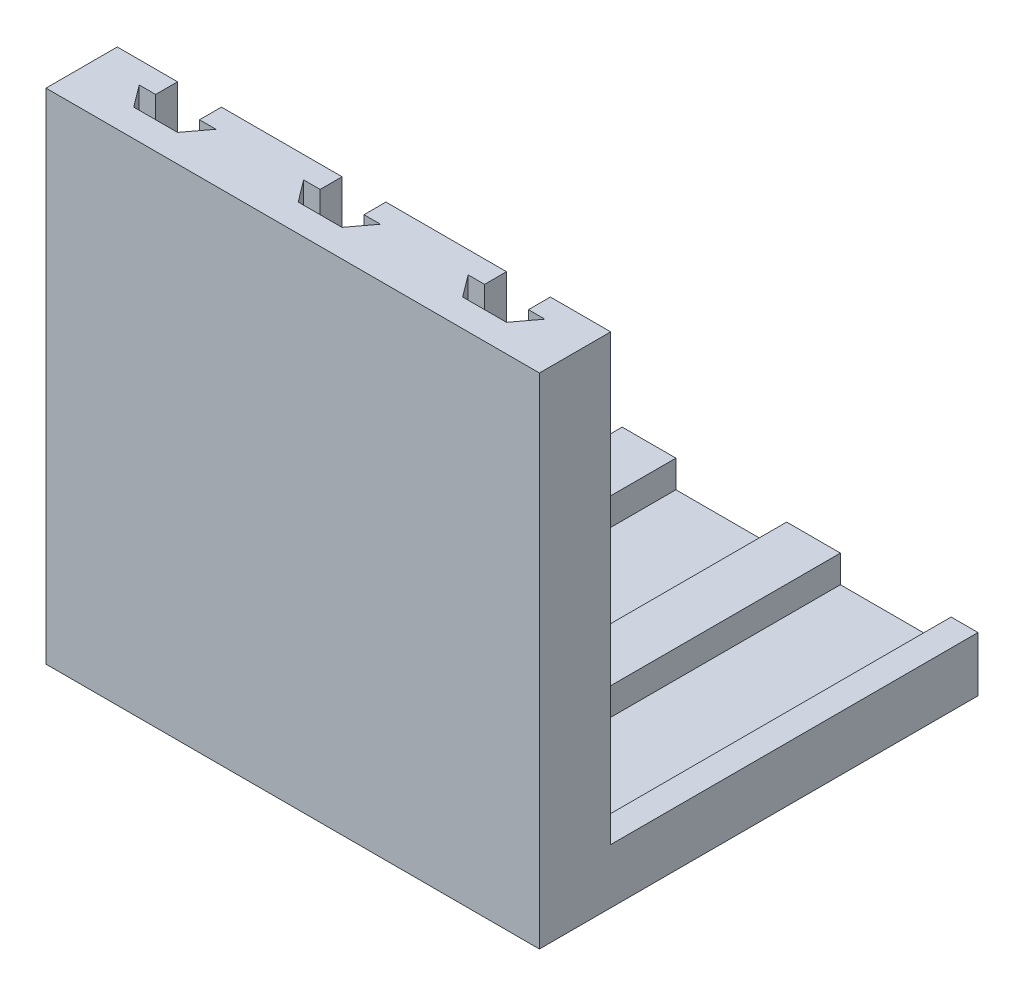
from build123d import *

# Parameters (mm, degrees)
SKETCH1_W           = 30
SKETCH1_H           = 80
BOSS_EXTRUDE1_DEPTH = 10
SKETCH2_W           = 30
SKETCH2_H           = 13
BOSS_EXTRUDE2_DEPTH = 81
CUT_EXTRUDE1_DEPTH  = 40
SKETCH4_W           = 20.2
SKETCH4_H           = 67
CUT_EXTRUDE2_DEPTH  = 5
SKETCH5_W           = 8
SKETCH5_H           = 2
CUT_EXTRUDE3_DEPTH  = 46
LPATTERN1_COUNT     = 3
LPATTERN1_PITCH     = 30


with BuildPart() as part:
    # Sketch1 → Boss-Extrude1 (new body)
    with BuildSketch(Plane(origin=(0, 0, 0), x_dir=(1, 0, 0), z_dir=(0, 1, 0))):
        Rectangle(SKETCH1_W, SKETCH1_H)
    boss_extrude1 = extrude(amount=BOSS_EXTRUDE1_DEPTH)

    # Sketch2 → Boss-Extrude2 (add)
    with BuildSketch(Plane(origin=(0, 10, 0), x_dir=(1, 0, 0), z_dir=(0, 1, 0))):
        with Locations((0, -33.5)):
            Rectangle(SKETCH2_W, SKETCH2_H)
    boss_extrude2 = extrude(amount=BOSS_EXTRUDE2_DEPTH)

    # Sketch3 → Cut-Extrude1 (cut)
    with BuildSketch(Plane(origin=(0, 91, 0), x_dir=(1, 0, 0), z_dir=(0, 1, 0))):
        Polygon((-4, -27), (4, -27), (4, -31), (7, -31), (4, -35), (-4, -35), (-7, -31), (-4, -31), align=None)
    cut_extrude1 = extrude(amount=-CUT_EXTRUDE1_DEPTH, mode=Mode.SUBTRACT)

    # Sketch4 → Cut-Extrude2 (cut)
    with BuildSketch(Plane(origin=(0, 10, 0), x_dir=(1, 0, 0), z_dir=(0, 1, 0))):
        with Locations((0, 6.5)):
            Rectangle(SKETCH4_W, SKETCH4_H)
    cut_extrude2 = extrude(amount=-CUT_EXTRUDE2_DEPTH, mode=Mode.SUBTRACT)

    # Sketch5 → Cut-Extrude3 (cut)
    with BuildSketch(Plane(origin=(0, 51, 0), x_dir=(1, 0, 0), z_dir=(0, 1, 0))):
        with Locations((0, -28)):
            Rectangle(SKETCH5_W, SKETCH5_H)
    cut_extrude3 = extrude(amount=-CUT_EXTRUDE3_DEPTH, mode=Mode.SUBTRACT)

    # LPattern1: Boss-Extrude1, Boss-Extrude2, Cut-Extrude1, Cut-Extrude2, Cut-Extrude3 ×3
    with Locations(*[(-i * LPATTERN1_PITCH, 0, 0) for i in range(1, LPATTERN1_COUNT)]):
        add(boss_extrude1)
        add(boss_extrude2)
        add(cut_extrude1, mode=Mode.SUBTRACT)
        add(cut_extrude2, mode=Mode.SUBTRACT)
        add(cut_extrude3, mode=Mode.SUBTRACT)


solid = part.part
